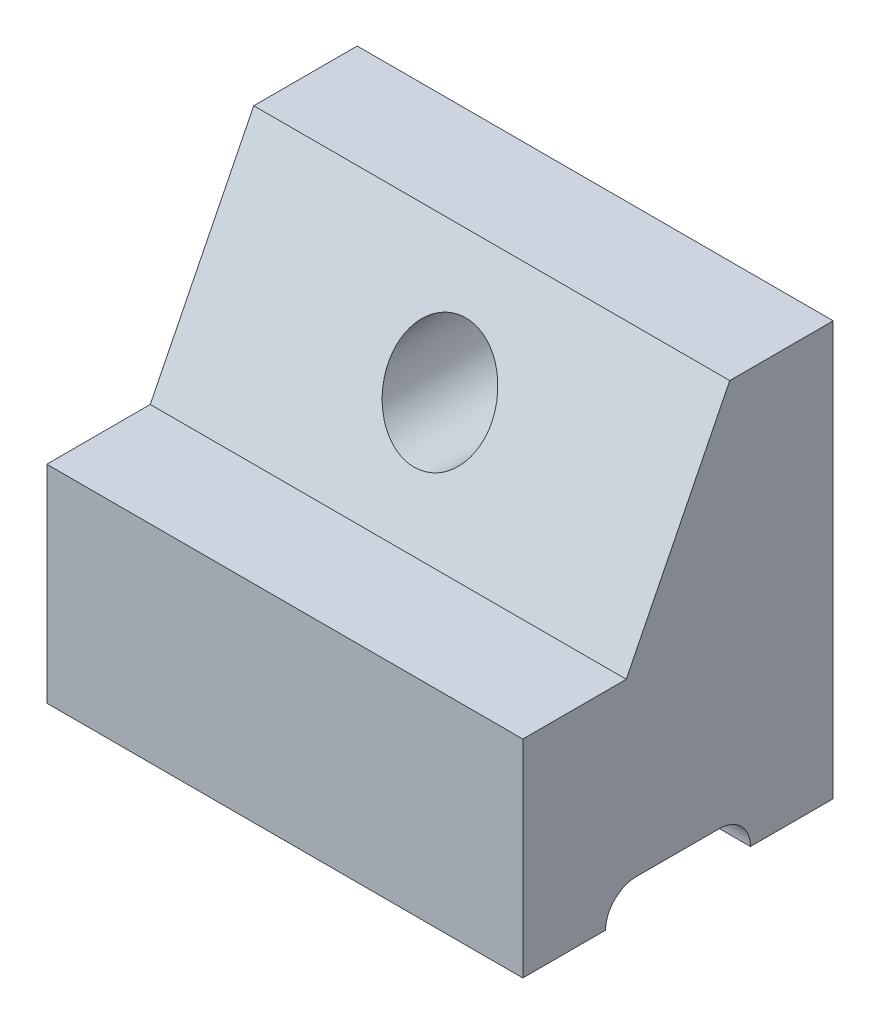
from build123d import *

# Parameters (mm, degrees)
SKETCH_1_W          = 46
SKETCH_1_H          = 40
EXTRUDE_1_DEPTH     = 15
SKETCH_2_R          = 5
CUT_EXTRUDE_1_DEPTH = 43.766809561
SKETCH_4_W          = 14
SKETCH_4_H          = 3
CUT_EXTRUDE_2_DEPTH = 53.354560451
FILLET_3_R          = 3
FILLET_8_R          = 3
CUT_EXTRUDE_3_DEPTH = 53.354560451


with BuildPart() as part:
    # 草圖1 → 填料-伸長1 (new, symmetric)
    with BuildSketch(Plane.XY):
        Rectangle(SKETCH_1_W, SKETCH_1_H)
    extrude(amount=EXTRUDE_1_DEPTH, both=True)

    # 草圖2 → 除料-伸長1 (cut, through all)
    with BuildSketch(Plane.XY.offset(15)):
        with Locations((0, 10)):
            Circle(SKETCH_2_R)
    extrude(amount=-CUT_EXTRUDE_1_DEPTH, mode=Mode.SUBTRACT)

    # 草圖4 → 除料-伸長2 (cut, through all)
    with BuildSketch(Plane(origin=(23, 0, 0), x_dir=(0, 0, -1), z_dir=(1, 0, 0))):
        with Locations((0, -18.5)):
            Rectangle(SKETCH_4_W, SKETCH_4_H)
    extrude(amount=-CUT_EXTRUDE_2_DEPTH, mode=Mode.SUBTRACT)

    # 圓角3
    fillet_3_edges = [part.edges().sort_by_distance(p)[0] for p in [
        (0, -17, 7),
    ]]
    fillet(fillet_3_edges, radius=FILLET_3_R - 0.0001)  # a hair under: the kernel refuses the full size

    # 圓角8
    fillet_8_edges = [part.edges().sort_by_distance(p)[0] for p in [
        (0, -17, -7),
    ]]
    fillet(fillet_8_edges, radius=FILLET_8_R - 0.0001)  # a hair under: the kernel refuses the full size

    # 草圖5 → 除料-伸長3 (cut, through all)
    with BuildSketch(Plane(origin=(23, 0, 0), x_dir=(0, 0, -1), z_dir=(1, 0, 0))):
        Polygon((-5, 0), (5, 20), (-5, 20), (-15, 20), (-15, 0), align=None)
    extrude(amount=-CUT_EXTRUDE_3_DEPTH, mode=Mode.SUBTRACT)


solid = part.part
